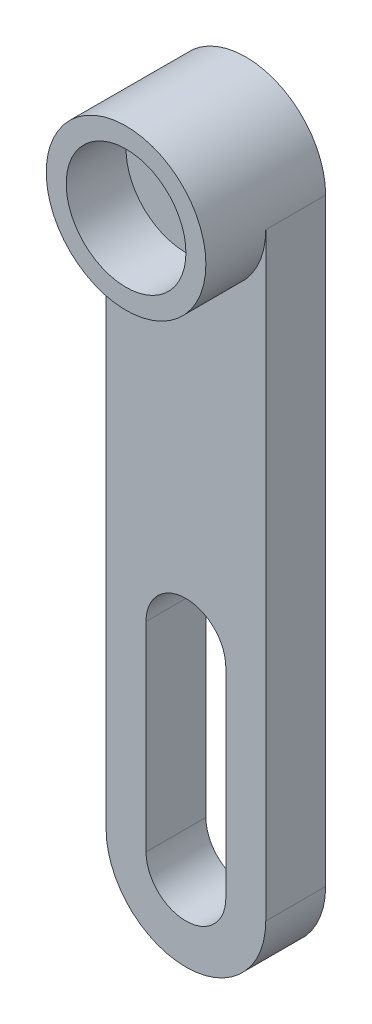
from build123d import *
from build123d.topology import SkipClean

# Parameters (mm, degrees)
SKETCH1_R           = 1.25
BOSS_EXTRUDE1_DEPTH = 3
SKETCH2_R           = 4
SKETCH2_R_2         = 3
BOSS_EXTRUDE2_DEPTH = 3


with BuildPart() as part:
    # Sketch1 → Boss-Extrude1 (new body)
    with BuildSketch(Plane.XY):
        with BuildLine():
            Line((4, 15), (4, -15))
            ThreePointArc((4, -15), (0, -19), (-4, -15))
            Line((-4, -15), (-4, 15))
            ThreePointArc((-4, 15), (0, 19), (4, 15))
        make_face()
        with Locations((0, 15)):
            Circle(SKETCH1_R, mode=Mode.SUBTRACT)
        with BuildLine():
            Line((-2, -5), (-2, -15))
            ThreePointArc((-2, -15), (0, -17), (2, -15))
            Line((2, -15), (2, -5))
            ThreePointArc((2, -5), (0, -3), (-2, -5))
        make_face(mode=Mode.SUBTRACT)
    extrude(amount=BOSS_EXTRUDE1_DEPTH)

    # Sketch2 → Boss-Extrude2 (add)
    with SkipClean():  # the faces are left unmerged after this step: merging them gives an invalid solid
        with BuildSketch(Plane.XY.offset(3)):
            with Locations((0, 15)):
                Circle(SKETCH2_R)
            with Locations((0, 15)):
                Circle(SKETCH2_R_2, mode=Mode.SUBTRACT)
        extrude(amount=BOSS_EXTRUDE2_DEPTH)
    add(part.part.scale(1), mode=Mode.REPLACE)  # the faces are merged on a copy


solid = part.part
